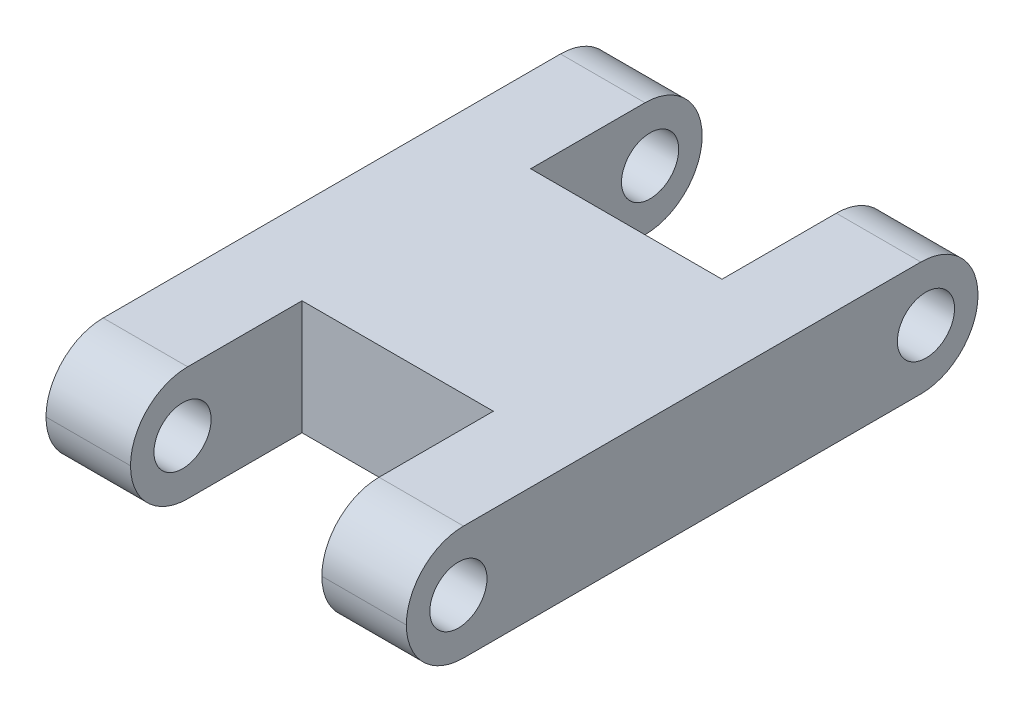
from build123d import *

# Parameters (mm, degrees)
BOSS_EXTRU_1_DEPTH      = 10
CONG_1_R                = 5
ESQUISSE2_R             = 2.5
ENL_V_MAT_EXTRU_1_DEPTH = 50


with BuildPart() as part:
    # Esquisse1 → Boss.-Extru.1 (new body)
    with BuildSketch(Plane(origin=(0, 0, 0), x_dir=(1, 0, 0), z_dir=(0, 1, 0))):
        Polygon((7.392201948, 0), (0, 0), (0, -50), (7.392201948, -50), (7.392201948, -35), (15.760023564, -35), (15.760023564, -15), (7.392201948, -15), align=None)
        Polygon((24.127845179, -15), (15.760023564, -15), (15.760023564, -35), (24.127845179, -35), (24.127845179, -50), (31.520047127, -50), (31.520047127, 0), (24.127845179, 0), align=None)
    extrude(amount=BOSS_EXTRU_1_DEPTH)

    # Congé1
    cong_1_edges = [part.edges().sort_by_distance(p)[0] for p in [
        (27.823946153, 0, 50),
        (3.696100974, 0, 50),
        (3.696100974, 10, 50),
        (27.823946153, 10, 50),
        (27.823946153, 10, 0),
        (27.823946153, 0, 0),
        (3.696100974, 0, 0),
        (3.696100974, 10, 0),
    ]]
    fillet(cong_1_edges, radius=CONG_1_R - 0.0001)  # a hair under: the kernel refuses the full size

    # Esquisse2 → Enlèv. mat.-Extru.1 (cut)
    with BuildSketch(Plane.ZY):
        with Locations((4.552174391, 5)):
            Circle(ESQUISSE2_R)
        with Locations((45.447825609, 5)):
            Circle(ESQUISSE2_R)
    extrude(amount=-ENL_V_MAT_EXTRU_1_DEPTH, mode=Mode.SUBTRACT)


solid = part.part
